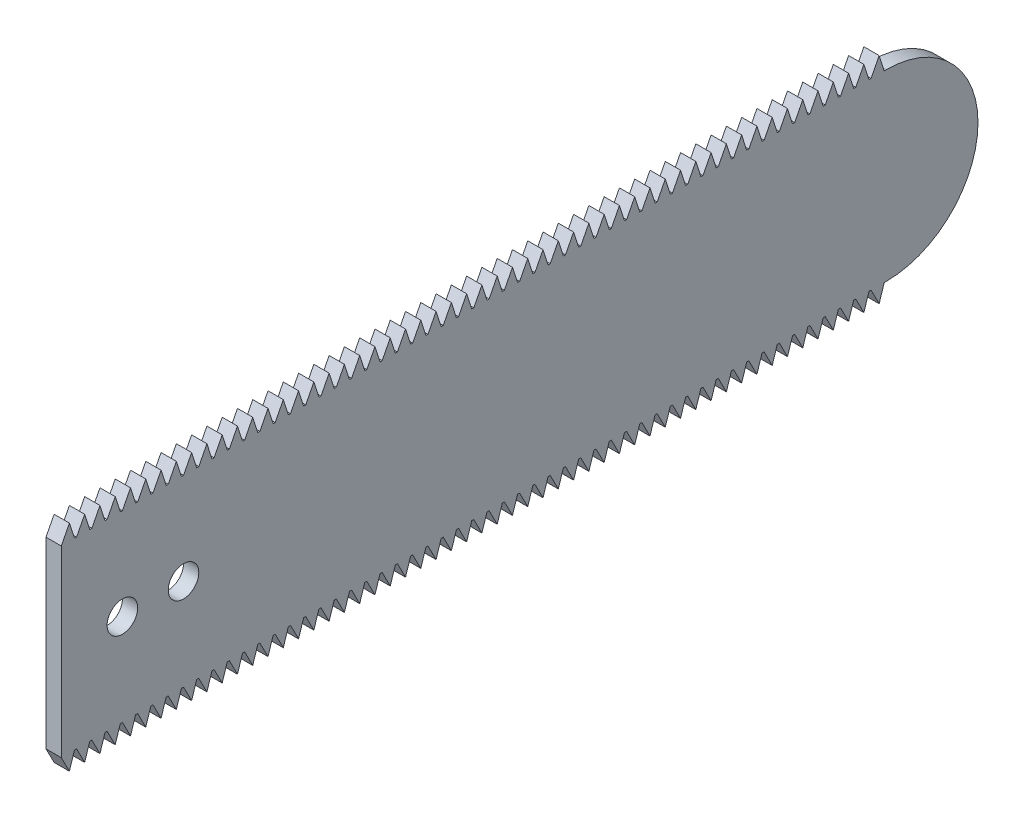
from build123d import *

# Parameters (mm, degrees)
SKIZZE1_W                       = 300
SKIZZE1_H                       = 60
AUFSATZ_LINEAR_AUSTRAGEN1_DEPTH = 5
SKIZZE2_R                       = 5
SCHNITT_LINEAR_AUSTRAGEN1_DEPTH = 5
VERRUNDUNG1_R                   = 30
AUFSATZ_LINEAR_AUSTRAGEN2_DEPTH = 5


with BuildPart() as part:
    # Skizze1 → Aufsatz-Linear austragen1 (new body)
    with BuildSketch(Plane(origin=(0, 0, 0), x_dir=(0, 0, -1), z_dir=(1, 0, 0))):
        with Locations((-5102.319034413, 1608.155092178)):
            Rectangle(SKIZZE1_W, SKIZZE1_H)
    extrude(amount=AUFSATZ_LINEAR_AUSTRAGEN1_DEPTH)

    # Skizze2 → Schnitt-Linear austragen1 (cut)
    with BuildSketch(Plane(origin=(5, 0, 0), x_dir=(0, 0, -1), z_dir=(1, 0, 0))):
        with Locations((-5232.319034413, 1608.155092178)):
            Circle(SKIZZE2_R)
        with Locations((-5212.319034413, 1608.155092178)):
            Circle(SKIZZE2_R)
    extrude(amount=-SCHNITT_LINEAR_AUSTRAGEN1_DEPTH, mode=Mode.SUBTRACT)

    # Verrundung1
    verrundung1_edges = [part.edges().sort_by_distance(p)[0] for p in [
        (2.5, 1578.155092178, 4952.319034413),
        (2.5, 1638.155092178, 4952.319034413),
    ]]
    fillet(verrundung1_edges, radius=VERRUNDUNG1_R - 0.0001)  # a hair under: the kernel refuses the full size

    # Skizze3 → Aufsatz-Linear austragen2 (add)
    with BuildSketch(Plane(origin=(5, 0, 0), x_dir=(0, 0, -1), z_dir=(1, 0, 0))):
        Polygon((-5252.319034413, 1638.155092178), (-5249.664283639, 1643.327688572), (-5248.000399453, 1638.155092178), align=None)
        Polygon((-5243.000399453, 1638.155092178), (-5247.319034413, 1638.155092178), (-5244.664283639, 1643.327688572), align=None)
        Polygon((-5238.000399453, 1638.155092178), (-5242.319034413, 1638.155092178), (-5239.664283639, 1643.327688572), align=None)
        Polygon((-5233.000399453, 1638.155092178), (-5237.319034413, 1638.155092178), (-5234.664283639, 1643.327688572), align=None)
        Polygon((-5228.000399453, 1638.155092178), (-5232.319034413, 1638.155092178), (-5229.664283639, 1643.327688572), align=None)
        Polygon((-5223.000399453, 1638.155092178), (-5227.319034413, 1638.155092178), (-5224.664283639, 1643.327688572), align=None)
        Polygon((-5218.000399453, 1638.155092178), (-5222.319034413, 1638.155092178), (-5219.664283639, 1643.327688572), align=None)
        Polygon((-5213.000399453, 1638.155092178), (-5217.319034413, 1638.155092178), (-5214.664283639, 1643.327688572), align=None)
        Polygon((-5208.000399453, 1638.155092178), (-5212.319034413, 1638.155092178), (-5209.664283639, 1643.327688572), align=None)
        Polygon((-5203.000399453, 1638.155092178), (-5207.319034413, 1638.155092178), (-5204.664283639, 1643.327688572), align=None)
        Polygon((-5198.000399453, 1638.155092178), (-5202.319034413, 1638.155092178), (-5199.664283639, 1643.327688572), align=None)
        Polygon((-5193.000399453, 1638.155092178), (-5197.319034413, 1638.155092178), (-5194.664283639, 1643.327688572), align=None)
        Polygon((-5188.000399453, 1638.155092178), (-5192.319034413, 1638.155092178), (-5189.664283639, 1643.327688572), align=None)
        Polygon((-5183.000399453, 1638.155092178), (-5187.319034413, 1638.155092178), (-5184.664283639, 1643.327688572), align=None)
        Polygon((-5178.000399453, 1638.155092178), (-5182.319034413, 1638.155092178), (-5179.664283639, 1643.327688572), align=None)
        Polygon((-5173.000399453, 1638.155092178), (-5177.319034413, 1638.155092178), (-5174.664283639, 1643.327688572), align=None)
        Polygon((-5168.000399453, 1638.155092178), (-5172.319034413, 1638.155092178), (-5169.664283639, 1643.327688572), align=None)
        Polygon((-5163.000399453, 1638.155092178), (-5167.319034413, 1638.155092178), (-5164.664283639, 1643.327688572), align=None)
        Polygon((-5158.000399453, 1638.155092178), (-5162.319034413, 1638.155092178), (-5159.664283639, 1643.327688572), align=None)
        Polygon((-5153.000399453, 1638.155092178), (-5157.319034413, 1638.155092178), (-5154.664283639, 1643.327688572), align=None)
        Polygon((-5148.000399453, 1638.155092178), (-5152.319034413, 1638.155092178), (-5149.664283639, 1643.327688572), align=None)
        Polygon((-5143.000399453, 1638.155092178), (-5147.319034413, 1638.155092178), (-5144.664283639, 1643.327688572), align=None)
        Polygon((-5138.000399453, 1638.155092178), (-5142.319034413, 1638.155092178), (-5139.664283639, 1643.327688572), align=None)
        Polygon((-5133.000399453, 1638.155092178), (-5137.319034413, 1638.155092178), (-5134.664283639, 1643.327688572), align=None)
        Polygon((-5128.000399453, 1638.155092178), (-5132.319034413, 1638.155092178), (-5129.664283639, 1643.327688572), align=None)
        Polygon((-5123.000399453, 1638.155092178), (-5127.319034413, 1638.155092178), (-5124.664283639, 1643.327688572), align=None)
        Polygon((-5118.000399453, 1638.155092178), (-5122.319034413, 1638.155092178), (-5119.664283639, 1643.327688572), align=None)
        Polygon((-5113.000399453, 1638.155092178), (-5117.319034413, 1638.155092178), (-5114.664283639, 1643.327688572), align=None)
        Polygon((-5108.000399453, 1638.155092178), (-5112.319034413, 1638.155092178), (-5109.664283639, 1643.327688572), align=None)
        Polygon((-5103.000399453, 1638.155092178), (-5107.319034413, 1638.155092178), (-5104.664283639, 1643.327688572), align=None)
        Polygon((-5098.000399453, 1638.155092178), (-5102.319034413, 1638.155092178), (-5099.664283639, 1643.327688572), align=None)
        Polygon((-5093.000399453, 1638.155092178), (-5097.319034413, 1638.155092178), (-5094.664283639, 1643.327688572), align=None)
        Polygon((-5088.000399453, 1638.155092178), (-5092.319034413, 1638.155092178), (-5089.664283639, 1643.327688572), align=None)
        Polygon((-5083.000399453, 1638.155092178), (-5087.319034413, 1638.155092178), (-5084.664283639, 1643.327688572), align=None)
        Polygon((-5078.000399453, 1638.155092178), (-5082.319034413, 1638.155092178), (-5079.664283639, 1643.327688572), align=None)
        Polygon((-5073.000399453, 1638.155092178), (-5077.319034413, 1638.155092178), (-5074.664283639, 1643.327688572), align=None)
        Polygon((-5068.000399453, 1638.155092178), (-5072.319034413, 1638.155092178), (-5069.664283639, 1643.327688572), align=None)
        Polygon((-5063.000399453, 1638.155092178), (-5067.319034413, 1638.155092178), (-5064.664283639, 1643.327688572), align=None)
        Polygon((-5058.000399453, 1638.155092178), (-5062.319034413, 1638.155092178), (-5059.664283639, 1643.327688572), align=None)
        Polygon((-5053.000399453, 1638.155092178), (-5057.319034413, 1638.155092178), (-5054.664283639, 1643.327688572), align=None)
        Polygon((-5048.000399453, 1638.155092178), (-5052.319034413, 1638.155092178), (-5049.664283639, 1643.327688572), align=None)
        Polygon((-5043.000399453, 1638.155092178), (-5047.319034413, 1638.155092178), (-5044.664283639, 1643.327688572), align=None)
        Polygon((-5038.000399453, 1638.155092178), (-5042.319034413, 1638.155092178), (-5039.664283639, 1643.327688572), align=None)
        Polygon((-5033.000399453, 1638.155092178), (-5037.319034413, 1638.155092178), (-5034.664283639, 1643.327688572), align=None)
        Polygon((-5028.000399453, 1638.155092178), (-5032.319034413, 1638.155092178), (-5029.664283639, 1643.327688572), align=None)
        Polygon((-5023.000399453, 1638.155092178), (-5027.319034413, 1638.155092178), (-5024.664283639, 1643.327688572), align=None)
        Polygon((-5018.000399453, 1638.155092178), (-5022.319034413, 1638.155092178), (-5019.664283639, 1643.327688572), align=None)
        Polygon((-5013.000399453, 1638.155092178), (-5017.319034413, 1638.155092178), (-5014.664283639, 1643.327688572), align=None)
        Polygon((-5008.000399453, 1638.155092178), (-5012.319034413, 1638.155092178), (-5009.664283639, 1643.327688572), align=None)
        Polygon((-5003.000399453, 1638.155092178), (-5007.319034413, 1638.155092178), (-5004.664283639, 1643.327688572), align=None)
        Polygon((-4998.000399453, 1638.155092178), (-5002.319034413, 1638.155092178), (-4999.664283639, 1643.327688572), align=None)
        Polygon((-4993.000399453, 1638.155092178), (-4997.319034413, 1638.155092178), (-4994.664283639, 1643.327688572), align=None)
        Polygon((-4988.000399453, 1638.155092178), (-4992.319034413, 1638.155092178), (-4989.664283639, 1643.327688572), align=None)
        Polygon((-4983.000399453, 1638.155092178), (-4987.319034413, 1638.155092178), (-4984.664283639, 1643.327688572), align=None)
    aufsatz_linear_austragen2 = extrude(amount=-AUFSATZ_LINEAR_AUSTRAGEN2_DEPTH)

    # Spiegeln1: Aufsatz-Linear austragen2 across plane
    add(aufsatz_linear_austragen2.mirror(Plane(origin=(0, 1608.155092178, 0), x_dir=(0, 0, 1), z_dir=(0, -1, 0))))


solid = part.part
